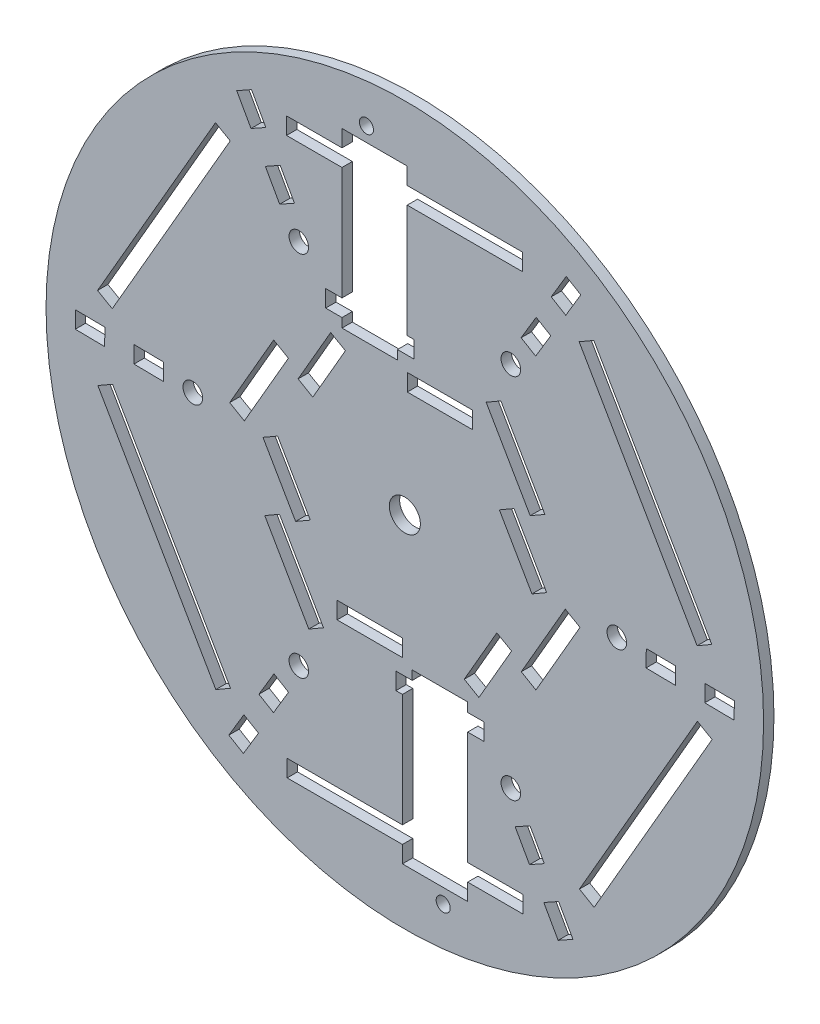
from build123d import *

# Parameters (mm, degrees)
SKETCH1_R           = 110
BOSS_EXTRUDE1_DEPTH = 1.5875
SKETCH2_R           = 2.15375
CUT_EXTRUDE3_DEPTH  = 156.595888844
CIRPATTERN1_COUNT   = 2
SKETCH11_R          = 3
SKETCH11_W          = 27
SKETCH11_H          = 5.2
SKETCH11_W_2        = 72.33
CUT_EXTRUDE24_DEPTH = 5


with BuildPart() as part:
    # Sketch1 → Boss-Extrude1 (new, symmetric)
    with BuildSketch(Plane.XY):
        Circle(SKETCH1_R)
        Polygon((2.2625, -40), (4.7625, -40), (16.7625, -40), (19.2625, -40), (19.2625, -93), (-0.7375, -93), (-0.7375, -48), (2.2625, -48), align=None, mode=Mode.SUBTRACT)
        Polygon((-2.2625, 40), (-4.7625, 40), (-16.7625, 40), (-19.2625, 40), (-19.2625, 93), (0.7375, 93), (0.7375, 48), (-2.2625, 48), align=None, mode=Mode.SUBTRACT)
        with BuildLine():
            ThreePointArc((4.7625, 0), (0, -4.7625), (-4.7625, 0))
            ThreePointArc((-4.7625, 0), (0, 4.7625), (4.7625, 0))
        make_face(mode=Mode.SUBTRACT)
    extrude(amount=BOSS_EXTRUDE1_DEPTH, both=True)

    # Sketch2 → Cut-Extrude3 (cut, through all)
    with BuildSketch(Plane.XY.offset(1.5875)):
        with Locations((11.7625, -97.43875)):
            Circle(SKETCH2_R)
    cut_extrude3 = extrude(amount=-CUT_EXTRUDE3_DEPTH, mode=Mode.SUBTRACT)

    # CirPattern1: Cut-Extrude3 ×2 about axis
    cirpattern1_axis = Axis((0, 0, 1.74625), (0, 0, -1))
    for i in range(1, CIRPATTERN1_COUNT):
        add(cut_extrude3.rotate(cirpattern1_axis, i * 360 / CIRPATTERN1_COUNT), mode=Mode.SUBTRACT)

    # Sketch11 → Cut-Extrude24 (cut, symmetric)
    with BuildSketch(Plane.XY.offset(1.5875)):
        with Locations((32.5, -56.291651246)):
            Circle(SKETCH11_R)
        with Locations((-32.5, -56.291651246)):
            Circle(SKETCH11_R)
        with Locations((-65, 0)):
            Circle(SKETCH11_R)
        with Locations((-32.5, 56.291651246)):
            Circle(SKETCH11_R)
        with Locations((32.5, 56.291651246)):
            Circle(SKETCH11_R)
        with Locations((65, 0)):
            Circle(SKETCH11_R)
        Polygon((-2.7375, -48), (24.2625, -48), (24.2625, -42.8), (19.2625, -42.8), (2.2625, -42.8), (-2.7375, -42.8), align=None)
        Polygon((-42.937969382, -21.629255457), (-29.437969382, -45.011941359), (-24.934637282, -42.411941359), (-38.434637282, -19.029255457), align=None)
        Polygon((-20.7625, -33.025), (-16.7625, -33.025), (-4.7625, -33.025), (-0.7625, -33.025), (-0.7625, -38.225), (-20.7625, -38.225), align=None)
        Polygon((-38.98173896, 1.468352446), (-36.98173896, -1.995749169), (-30.98173896, -12.388054014), (-28.98173896, -15.85215563), (-33.48507106, -18.45215563), (-43.48507106, -1.131647554), align=None)
        Polygon((-40.200469382, 26.370744543), (-53.700469382, 2.988058641), (-49.197137282, 0.388058641), (-35.697137282, 23.770744543), align=None)
        Polygon((-18.21923896, 34.493352446), (-20.21923896, 31.029250831), (-26.21923896, 20.636945986), (-28.21923896, 17.17284437), (-32.72257106, 19.77284437), (-22.72257106, 37.093352446), align=None)
        with Locations((-10.7625, 45.4)):
            Rectangle(SKETCH11_W, SKETCH11_H)
        Polygon((42.937969382, 21.629255457), (29.437969382, 45.011941359), (24.934637282, 42.411941359), (38.434637282, 19.029255457), align=None)
        Polygon((20.7625, 33.025), (16.7625, 33.025), (4.7625, 33.025), (0.7625, 33.025), (0.7625, 38.225), (20.7625, 38.225), align=None)
        Polygon((40.200469382, -26.370744543), (53.700469382, -2.988058641), (49.197137282, -0.388058641), (35.697137282, -23.770744543), align=None)
        Polygon((38.98173896, -1.468352446), (36.98173896, 1.995749169), (30.98173896, 12.388054014), (28.98173896, 15.85215563), (33.48507106, 18.45215563), (43.48507106, 1.131647554), align=None)
        Polygon((18.21923896, -34.493352446), (20.21923896, -31.029250831), (26.21923896, -20.636945986), (28.21923896, -17.17284437), (32.72257106, -19.77284437), (22.72257106, -37.093352446), align=None)
        with Locations((0.0975, -85.239379798)):
            Rectangle(SKETCH11_W_2, SKETCH11_H)
        Polygon((-53.436552258, -72.723936104), (-89.601552258, -10.084318648), (-94.104884358, -12.684318648), (-57.939884358, -75.323936104), align=None)
        Polygon((-89.699052258, 9.915443694), (-53.534052258, 72.55506115), (-58.037384358, 75.15506115), (-94.202384358, 12.515443694), align=None)
        with Locations((-0.0975, 85.239379798)):
            Rectangle(SKETCH11_W_2, SKETCH11_H)
        Polygon((53.436552258, 72.723936104), (89.601552258, 10.084318648), (94.104884358, 12.684318648), (57.939884358, 75.323936104), align=None)
        Polygon((89.699052258, -9.915443694), (53.534052258, -72.55506115), (58.037384358, -75.15506115), (94.202384358, -12.515443694), align=None)
        Polygon((-42.501009219, -71.292806196), (-44.734277847, -69.961449281), (-40.125734679, -62.230904031), (-35.659197423, -64.893617861), (-40.267740591, -72.624163112), align=None)
        Polygon((-47.109552388, -79.023351447), (-49.342821015, -77.691994531), (-53.951364184, -85.422539781), (-49.484826928, -88.085253612), (-44.87628376, -80.354708362), align=None)
        Polygon((-91.991006039, 1.286393405), (-91.954651442, 3.886139228), (-100.953771598, 4.011982061), (-101.026480791, -1.187509584), (-92.027360635, -1.313352418), align=None)
        Polygon((-83.028240479, -1.439195251), (-82.991885883, 1.160550572), (-82.955531286, 3.760296395), (-73.956411131, 3.634453562), (-74.029120323, -1.565038084), align=None)
        Polygon((-44.881453651, 80.309744852), (-42.611830427, 81.578133759), (-47.002407415, 89.434521843), (-51.541653863, 86.897744028), (-47.151076875, 79.041355944), align=None)
        Polygon((-42.760499888, 71.184967861), (-40.490876664, 72.453356768), (-38.221253439, 73.721745676), (-33.830676452, 65.865357593), (-38.3699229, 63.328579778), align=None)
        Polygon((47.109552388, 79.023351447), (49.342821015, 77.691994531), (53.951364184, 85.422539781), (49.484826928, 88.085253612), (44.87628376, 80.354708362), align=None)
        Polygon((40.267740591, 72.624163112), (42.501009219, 71.292806196), (44.734277847, 69.961449281), (40.125734679, 62.230904031), (35.659197423, 64.893617861), align=None)
        Polygon((91.991006039, -1.286393405), (91.954651442, -3.886139228), (100.953771598, -4.011982061), (101.026480791, 1.187509584), (92.027360635, 1.313352418), align=None)
        Polygon((83.028240479, 1.439195251), (82.991885883, -1.160550572), (82.955531286, -3.760296395), (73.956411131, -3.634453562), (74.029120323, 1.565038084), align=None)
        Polygon((44.881453651, -80.309744852), (42.611830427, -81.578133759), (47.002407415, -89.434521843), (51.541653863, -86.897744028), (47.151076875, -79.041355944), align=None)
        Polygon((42.760499888, -71.184967861), (40.490876664, -72.453356768), (38.221253439, -73.721745676), (33.830676452, -65.865357593), (38.3699229, -63.328579778), align=None)
    extrude(amount=CUT_EXTRUDE24_DEPTH, both=True, mode=Mode.SUBTRACT)


solid = part.part
